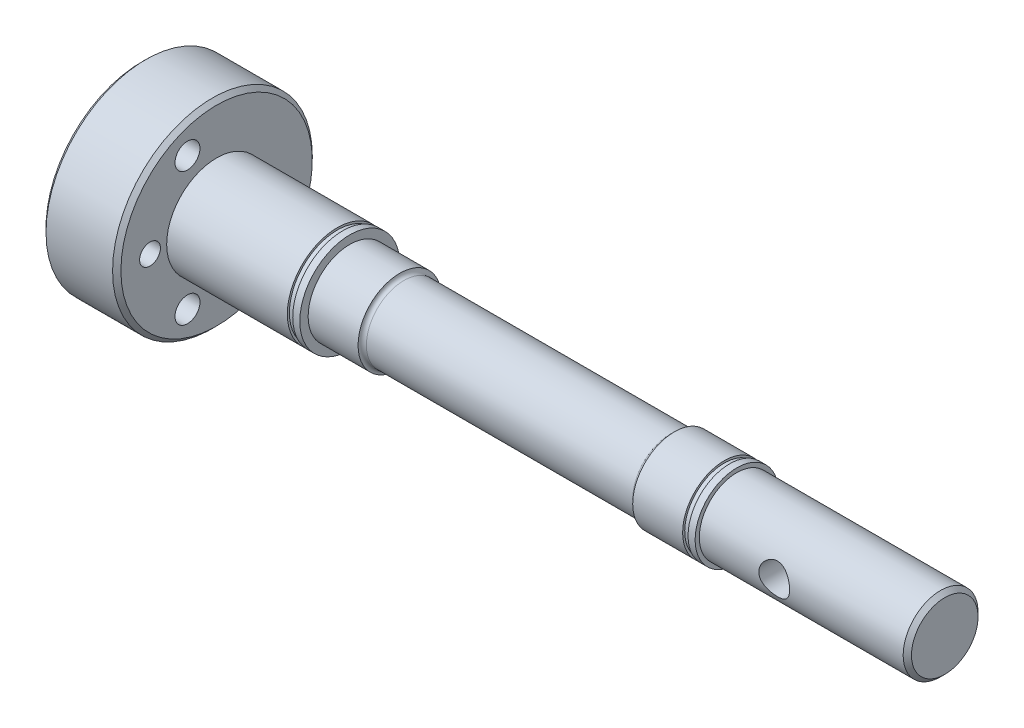
from build123d import *

# Parameters (mm, degrees)
ESQUISSE2_W             = 1.3
ESQUISSE2_H             = 0.5
CONG_1_R                = 1
CHANFREIN1_SIZE         = 1
ESQUISSE3_R             = 3.7
ENL_V_MAT_EXTRU_1_DEPTH = 10
ESQUISSE4_R             = 3
ESQUISSE4_R_2           = 2.5
ENL_V_MAT_EXTRU_2_DEPTH = 196.961730958
ESQUISSE6_W             = 1.3
ESQUISSE6_H             = 0.5


with BuildPart() as part:
    # Esquisse1 → Base-Révolution (revolve)
    with BuildSketch(Plane.XY, mode=Mode.PRIVATE) as base_r_volution_sk:
        Polygon((0, 0), (0, 24), (18, 24), (18, 12), (50, 12), (50, 10), (62, 10), (62, 9), (128, 9), (128, 10), (143, 10), (143, 9), (193, 9), (193, 0), align=None)
    revolve(base_r_volution_sk.sketch.rotate(Axis((-48.771720193, 0, 0), (1, 0, 0)), 90), axis=Axis((-48.771720193, 0, 0), (1, 0, 0)))

    # Esquisse2 → Enlèvement de matière-Révolution1 (revolve, cut)
    with BuildSketch(Plane.XY, mode=Mode.PRIVATE) as enl_vement_de_mati_re_r_volution1_sk:
        with Locations((47.65, 11.75)):
            Rectangle(ESQUISSE2_W, ESQUISSE2_H)
    revolve(enl_vement_de_mati_re_r_volution1_sk.sketch.rotate(Axis((0, 0, 0), (1, 0, 0)), 90), axis=Axis((0, 0, 0), (1, 0, 0)), mode=Mode.SUBTRACT)

    # Congé1
    cong_1_edges = [part.edges().sort_by_distance(p)[0] for p in [
        (62, 0, -9),
        (128, 0, -9),
    ]]
    fillet(cong_1_edges, radius=CONG_1_R - 0.0001)  # a hair under: the kernel refuses the full size

    # Chanfrein1
    chanfrein1_edges = [part.edges().sort_by_distance(p)[0] for p in [
        (193, 0, -9),
        (18, 0, -24),
        (0, 0, -24),
    ]]
    chamfer(chanfrein1_edges, length=CHANFREIN1_SIZE)

    # Esquisse3 → Enlèv. mat.-Extru.1 (cut, symmetric)
    with BuildSketch(Plane.XY):
        with Locations((161, 0)):
            Circle(ESQUISSE3_R)
    extrude(amount=ENL_V_MAT_EXTRU_1_DEPTH, both=True, mode=Mode.SUBTRACT)

    # Esquisse4 → Enlèv. mat.-Extru.2 (cut, through all)
    with BuildSketch(Plane.ZY):
        with Locations((7, 16)):
            Circle(ESQUISSE4_R)
        with Locations((7, -16)):
            Circle(ESQUISSE4_R)
        with Locations((16, 0)):
            Circle(ESQUISSE4_R_2)
    extrude(amount=-ENL_V_MAT_EXTRU_2_DEPTH, mode=Mode.SUBTRACT)

    # Esquisse6 → Enlèvement de matière-Révolution2 (revolve, cut)
    with BuildSketch(Plane.XY, mode=Mode.PRIVATE) as enl_vement_de_mati_re_r_volution2_sk:
        with Locations((140.65, 9.75)):
            Rectangle(ESQUISSE6_W, ESQUISSE6_H)
    revolve(enl_vement_de_mati_re_r_volution2_sk.sketch.rotate(Axis((141.562186711, 0, 0), (1, 0, 0)), 90), axis=Axis((141.562186711, 0, 0), (1, 0, 0)), mode=Mode.SUBTRACT)


solid = part.part
